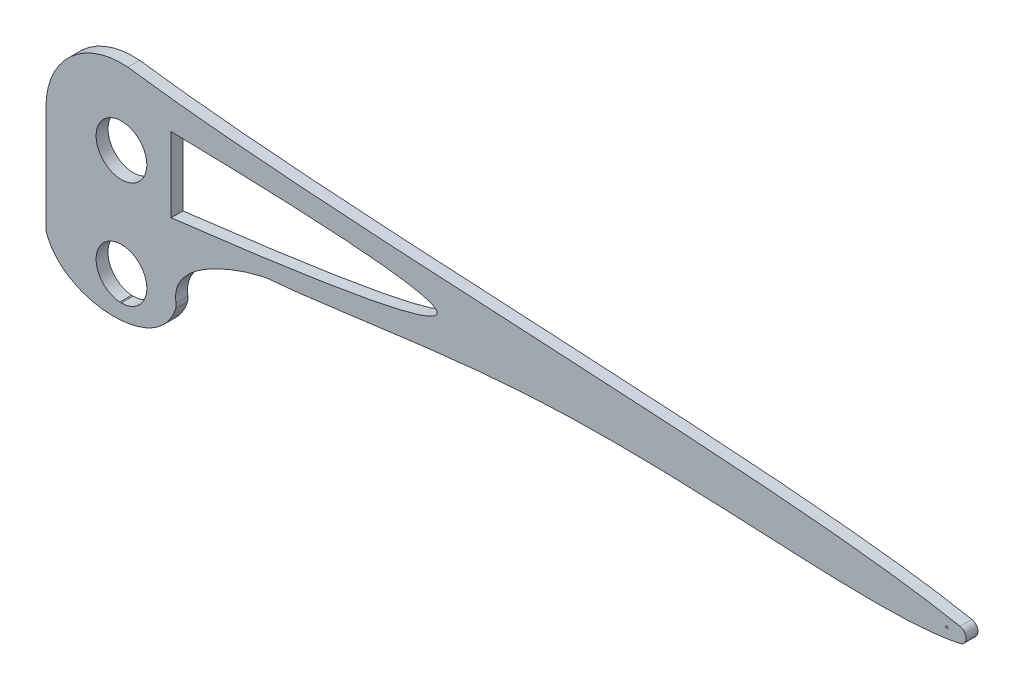
from build123d import *

# Parameters (mm, degrees)
SKETCH1_R               = 8.466666667
BOSS_EXTRUDE1_DEPTH     = 3.96875
SCALE1_SCALE            = 0.75
CUT_EXTRUDE1_DEPTH      = 234.957588664
CUT_EXTRUDE1_DEPTH_BACK = 234.957588664
CUT_EXTRUDE2_DEPTH      = 234.957588664
CUT_EXTRUDE2_DEPTH_BACK = 234.957588664
SKETCH3_R               = 0.28575


with BuildPart() as part:
    # Sketch1 → Boss-Extrude1 (new body)
    with BuildSketch(Plane.XY):
        with BuildLine():
            ThreePointArc((2.090204907, 25.105012471), (-17.058347301, 18.537621075), (-25.191875828, 0))
            Line((-25.191875828, 0), (-25.191875828, -35.215356132))
            ThreePointArc((-25.191875828, -35.215356132), (-25.144594979, -35.781140778), (-25.004063999, -36.331230578))
            add(Edge.make_bspline(
                [(-25.004063999, -36.331230578), (-24.302161584, -38.357321078), (-17.500345693, -49.472928078), (6.486565439, -52.353017034), (16.828257208, -40.890808587), (18.117618202, -36.640731795)],
                knots=[0.011286064, 0.011286064, 0.011286064, 0.011286064, 0.130987572, 0.750185474, 0.983991621, 0.983991621, 0.983991621, 0.983991621], degree=3))
            ThreePointArc((18.117618202, -36.640731795), (18.258374718, -35.854153527), (18.212152653, -35.056418427))
            add(Edge.make_bspline(
                [(18.212152653, -35.056418427), (15.722327617, -21.003254002), (45.083704914, -12.577387864), (50.314621311, -12.487786805)],
                knots=[0.243688719, 0.243688719, 0.243688719, 0.243688719, 1, 1, 1, 1], degree=3))
            add(Edge.make_bspline(
                [(50.314621311, -12.487786805), (67.828969762, -11.217353563), (162.851239243, 6.097445829), (250.038282618, -9.041784468), (279.934807735, -2.602592093)],
                knots=[0.23584572, 0.23584572, 0.23584572, 0.23584572, 0.495200792, 0.941477437, 0.941477437, 0.941477437, 0.941477437], degree=3))
            ThreePointArc((279.934807735, -2.602592093), (281.939894054, -0.09633433), (279.889362488, 2.372880002))
            add(Edge.make_bspline(
                [(2.090204907, 25.105012471), (29.372633882, 21.318909318), (128.041674084, 14.540572725), (239.548411309, 10.293455518), (279.889362488, 2.372880002)],
                knots=[0.008543469, 0.008543469, 0.008543469, 0.008543469, 0.340594684, 0.94139515, 0.94139515, 0.94139515, 0.94139515], degree=3))
        make_face()
        with Locations((0, -35.685560836)):
            Circle(SKETCH1_R, mode=Mode.SUBTRACT)
        Circle(SKETCH1_R, mode=Mode.SUBTRACT)
    extrude(amount=BOSS_EXTRUDE1_DEPTH)


with BuildPart() as part_1:
    # Scale1: scaled about (77.999858925, -1.061931611, 1.984375)
    add(part.part.scale(SCALE1_SCALE).moved(Location((19.499964731, -0.265482903, 0.49609375))))

    # Sketch2 → Cut-Extrude1 (cut, two sides: drawn at the far end of the back side and taken through both)
    with BuildSketch(Plane.XY.offset(3.472656424).offset(-CUT_EXTRUDE1_DEPTH_BACK)):
        with BuildLine():
            Line((31.923276194, -8.669949019), (31.923276194, 10.020002836))
            add(Edge.make_bspline(
                [(31.923276194, 10.020002836), (165.110282537, 7.314969964), (31.923276194, -8.669949019)],
                knots=[0, 0, 0, 1, 1, 1], degree=2))
        make_face()
    extrude(amount=CUT_EXTRUDE1_DEPTH + CUT_EXTRUDE1_DEPTH_BACK, mode=Mode.SUBTRACT)

    # Sketch3 → Cut-Extrude2 (cut, two sides: drawn at the far end of the back side and taken through both)
    with BuildSketch(Plane.XY.offset(3.472656424).offset(-CUT_EXTRUDE2_DEPTH_BACK)):
        with Locations((19.266230894, -33.149528109)):
            Circle(SKETCH3_R)
        with Locations((226.12693778, -0.374743535)):
            Circle(SKETCH3_R)
    extrude(amount=CUT_EXTRUDE2_DEPTH + CUT_EXTRUDE2_DEPTH_BACK, mode=Mode.SUBTRACT)


solid = part_1.part
